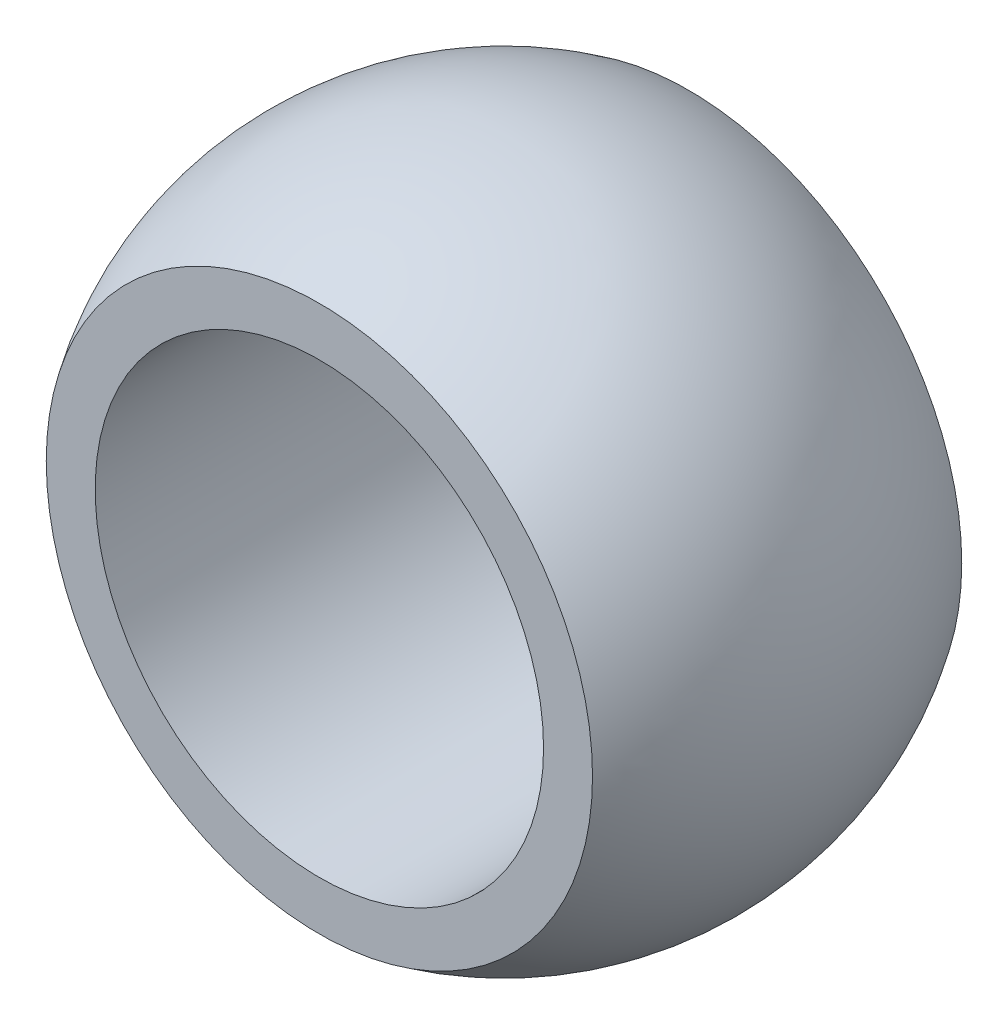
from build123d import *

# Parameters (mm, degrees)
ESQUISSE_FACES_W = 25
ESQUISSE_FACES_H = 7
FACES_2_DEPTH    = 28
DIA_AL_SAGE_R    = 8.5
AL_SAGE_DEPTH    = 27.320144377


with BuildPart() as part:
    # Esquisse sphère → Sphère extérieur (revolve)
    with BuildSketch(Plane.XY):
        with BuildLine():
            Line((0, 12.5), (0, -12.5))
            ThreePointArc((0, -12.5), (12.5, 0), (0, 12.5))
        make_face()
    revolve(axis=Axis((0, 17, 0), (0, -1, 0)))

    # Esquisse faces → Faces 2 (cut, symmetric)
    with BuildSketch(Plane(origin=(0, 0, 0), x_dir=(1, 0, 0), z_dir=(0, 1, 0))):
        with Locations((1.5, -10.5)):
            Rectangle(ESQUISSE_FACES_W, ESQUISSE_FACES_H)
        with Locations((1.5, 10.5)):
            Rectangle(ESQUISSE_FACES_W, ESQUISSE_FACES_H)
    extrude(amount=FACES_2_DEPTH, both=True, mode=Mode.SUBTRACT)

    # Dia alésage → Alésage (cut, through all)
    with BuildSketch(Plane.XY.offset(7)):
        Circle(DIA_AL_SAGE_R)
    extrude(amount=-AL_SAGE_DEPTH, mode=Mode.SUBTRACT)


solid = part.part
